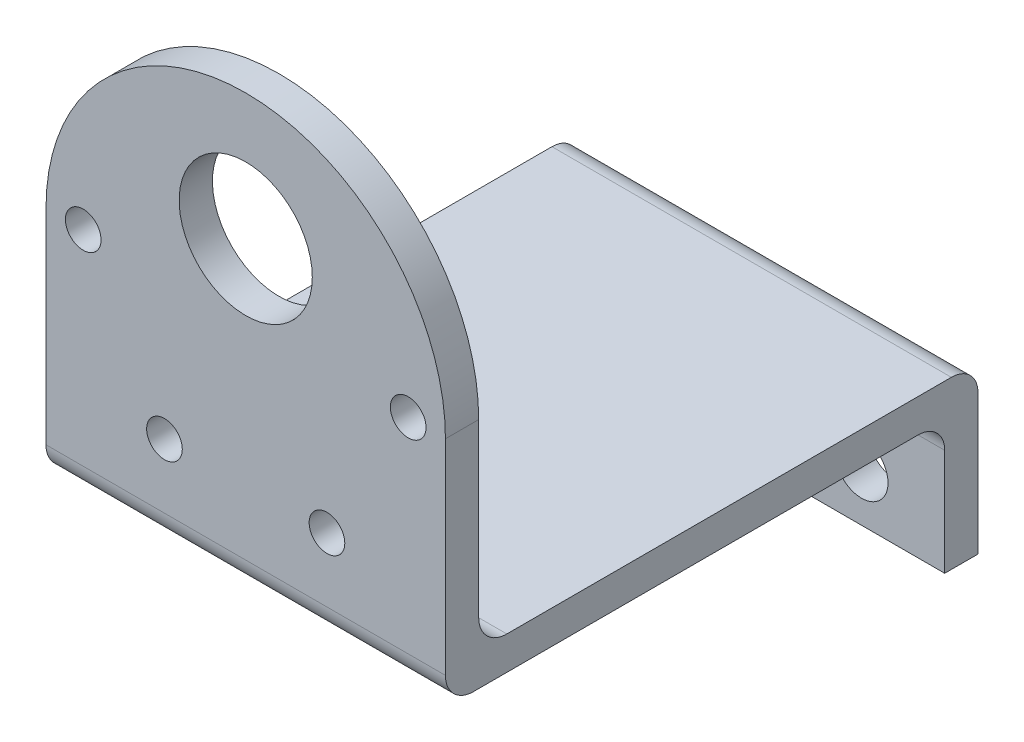
from build123d import *

# Parameters (mm, degrees)
BOSS_EXTRUDE1_DEPTH        = 38.1
F_8_0_199_DIAMETER_HOLE1_D = 5.0546
SKETCH11_R                 = 6.350000009
CUT_EXTRUDE1_DEPTH         = 77.185209693
M3_CLEARANCE_HOLE1_D       = 3.4


with BuildPart() as part:
    # Sketch1 → Boss-Extrude1 (new body)
    with BuildSketch(Plane(origin=(0, 0, 0), x_dir=(0, 0, -1), z_dir=(1, 0, 0))):
        with BuildLine():
            Line((0, 42.094372261), (0, 6.675328802))
            ThreePointArc((0, 6.675328802), (0.785233991, 4.779606252), (2.680956542, 3.994372261))
            Line((2.680956542, 3.994372261), (45.085, 3.994372261))
            ThreePointArc((45.085, 3.994372261), (46.881051224, 3.250423485), (47.625, 1.454372261))
            Line((47.625, 1.454372261), (47.625, -11.880627739))
            Line((47.625, -11.880627739), (44.45, -11.880627739))
            Line((44.45, -11.880627739), (44.45, -1.720627739))
            ThreePointArc((44.45, -1.720627739), (43.706051224, 0.075423485), (41.91, 0.819372261))
            Line((41.91, 0.819372261), (-0.494043458, 0.819372261))
            ThreePointArc((-0.494043458, 0.819372261), (-2.389766009, 1.604606252), (-3.175, 3.500328802))
            Line((-3.175, 3.500328802), (-3.175, 42.094372261))
            Line((-3.175, 42.094372261), (0, 42.094372261))
        make_face()
    extrude(amount=BOSS_EXTRUDE1_DEPTH)

    # #8 (0.199) Diameter Hole1 (through all)
    with Locations(Plane.XY.offset(-44.45)):
        with Locations((7.9375, -7.118127739), (30.1625, -7.118127739)):
            Hole(F_8_0_199_DIAMETER_HOLE1_D / 2)

    # Sketch11 → Cut-Extrude1 (cut, through all)
    with BuildSketch(Plane.XY.offset(3.175)):
        with BuildLine():
            Line((38.1, 42.094372261), (19.05, 42.094372261))
            ThreePointArc((19.05, 42.094372261), (32.520384182, 36.514756442), (38.1, 23.044372261))
            Line((38.1, 23.044372261), (38.1, 42.094372261))
        make_face()
        with BuildLine():
            Line((0, 42.094372261), (0, 23.044372261))
            ThreePointArc((0, 23.044372261), (5.579615818, 36.514756442), (19.05, 42.094372261))
            Line((19.05, 42.094372261), (0, 42.094372261))
        make_face()
        with Locations((19.05, 30.044372231)):
            Circle(SKETCH11_R)
    extrude(amount=-CUT_EXTRUDE1_DEPTH, mode=Mode.SUBTRACT)

    # M3 Clearance Hole1 (through all)
    with Locations(Plane.XY.offset(3.175)):
        with Locations((3.55, 23.044372261), (34.55, 23.044372261), (26.8, 9.620978502), (11.3, 9.620978502)):
            Hole(M3_CLEARANCE_HOLE1_D / 2)


solid = part.part
